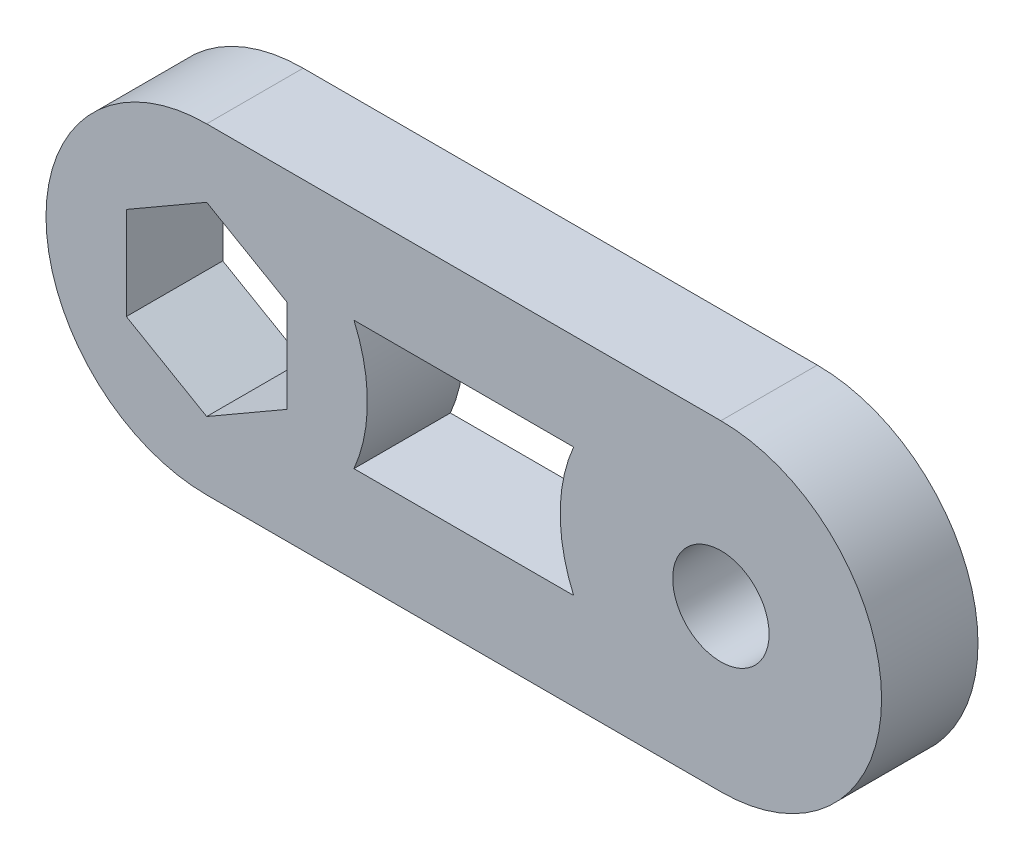
from build123d import *

# Parameters (mm, degrees)
SKETCH1_R          = 1.5
EXTRUDE1_DEPTH     = 3
CUT_EXTRUDE1_START = -10
SKETCH2_R          = 1.5
CUT_EXTRUDE1_DEPTH = 10


with BuildPart() as part:
    # Sketch1 → Extrude1 (new body)
    with BuildSketch(Plane.XY):
        with BuildLine():
            ThreePointArc((0, 5), (-5, 0), (0, -5))
            Line((0, -5), (16, -5))
            ThreePointArc((16, -5), (21, 0), (16, 5))
            Line((16, 5), (0, 5))
        make_face()
        Circle(SKETCH1_R, mode=Mode.SUBTRACT)
        with BuildLine():
            ThreePointArc((17.5, 0), (16, -1.5), (14.5, 0))
            ThreePointArc((14.5, 0), (16, 1.5), (17.5, 0))
        make_face(mode=Mode.SUBTRACT)
    extrude(amount=EXTRUDE1_DEPTH)

    # Sketch2 → Cut-Extrude1 (cut)
    with BuildSketch(Plane.XY.offset(3).offset(CUT_EXTRUDE1_START)):
        with Locations((16, 0)):
            Circle(SKETCH2_R)
        Polygon((0, 2.886751346), (-2.5, 1.443375673), (-2.5, -1.443375673), (0, -2.886751346), (2.5, -1.443375673), (2.5, 1.443375673), align=None)
        with BuildLine():
            Line((4.582575695, -2), (11.417424305, -2))
            ThreePointArc((11.417424305, -2), (11, 0), (11.417424305, 2))
            Line((11.417424305, 2), (4.582575695, 2))
            ThreePointArc((4.582575695, 2), (5, 0), (4.582575695, -2))
        make_face()
    extrude(amount=CUT_EXTRUDE1_DEPTH, mode=Mode.SUBTRACT)


solid = part.part
